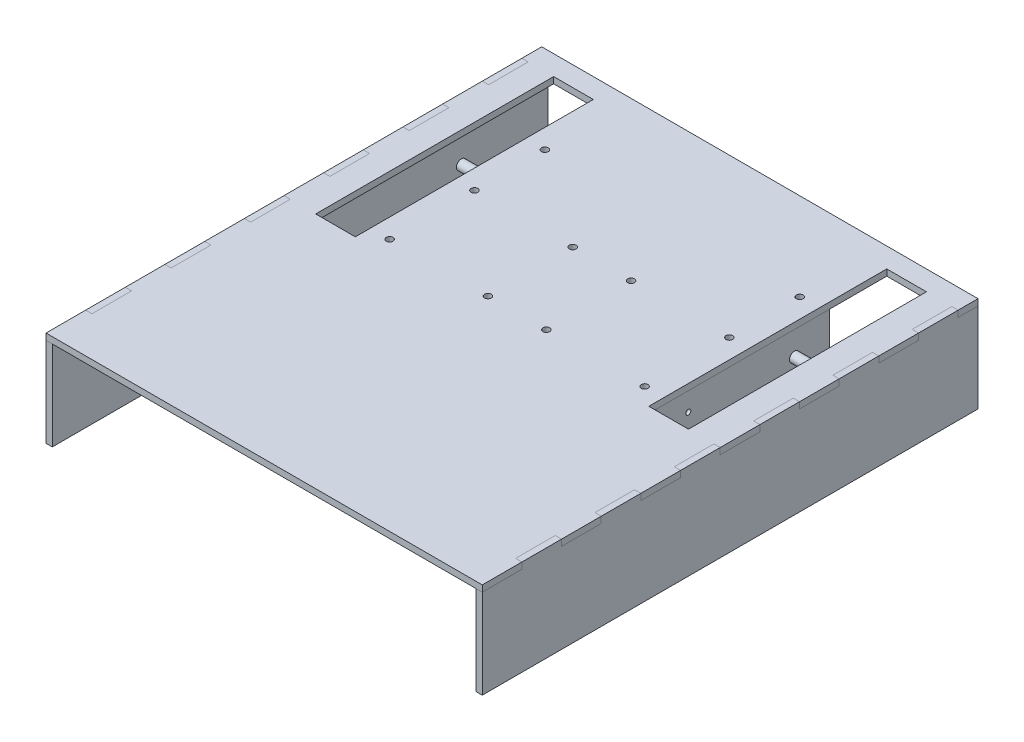
from build123d import *

# Parameters (mm, degrees)
SKETCH2_W           = 20
SKETCH2_H           = 120
BOSS_EXTRUDE1_DEPTH = 3.175
BOSS_EXTRUDE2_DEPTH = 3.175
BOSS_EXTRUDE3_DEPTH = 1.6129
SKETCH6_W           = 1.6129
SKETCH6_H           = 87.408244493
SKETCH6_R           = 17.56918
SKETCH6_R_2         = 2.55
SKETCH6_R_3         = 1.27
SKETCH6_R_4         = 2.3749
BOSS_EXTRUDE4_DEPTH = 1.6129
SKETCH7_R           = 1.7
CUT_EXTRUDE1_DEPTH  = 10
SKETCH9_R           = 2.5
BOSS_EXTRUDE6_DEPTH = 189


with BuildPart() as part:
    # Sketch2 → Boss-Extrude1 (new body)
    with BuildSketch(Plane(origin=(0, 0, 0), x_dir=(1, 0, 0), z_dir=(0, 1, 0))):
        Polygon((-162.266187111, -88.214102909), (57.733812889, -88.214102909), (57.733812889, -68.214102909), (54.558812889, -68.214102909), (54.558812889, -48.214102909), (57.733812889, -48.214102909), (57.733812889, -28.214102909), (54.558812889, -28.214102909), (54.558812889, -8.214102909), (57.733812889, -8.214102909), (57.733812889, 11.785897091), (54.558812889, 11.785897091), (54.558812889, 31.785897091), (57.733812889, 31.785897091), (57.733812889, 51.785897091), (54.558812889, 51.785897091), (54.558812889, 71.785897091), (57.733812889, 71.785897091), (57.733812889, 91.785897091), (54.558812889, 91.785897091), (54.558812889, 111.785897091), (57.733812889, 111.785897091), (57.733812889, 131.785897091), (54.558812889, 131.785897091), (54.558812889, 151.785897091), (57.733812889, 151.785897091), (57.733812889, 161.785897091), (-162.266187111, 161.785897091), (-162.266187111, 151.785897091), (-159.091187111, 151.785897091), (-159.091187111, 131.785897091), (-162.266187111, 131.785897091), (-162.266187111, 111.785897091), (-159.091187111, 111.785897091), (-159.091187111, 91.785897091), (-162.266187111, 91.785897091), (-162.266187111, 71.785897091), (-159.091187111, 71.785897091), (-159.091187111, 51.785897091), (-162.266187111, 51.785897091), (-162.266187111, 31.785897091), (-159.091187111, 31.785897091), (-159.091187111, 11.785897091), (-162.266187111, 11.785897091), (-162.266187111, -8.214102909), (-159.091187111, -8.214102909), (-159.091187111, -28.214102909), (-162.266187111, -28.214102909), (-162.266187111, -48.214102909), (-159.091187111, -48.214102909), (-159.091187111, -68.214102909), (-162.266187111, -68.214102909), align=None)
        with Locations((31.733812889, 91.785897091)):
            Rectangle(SKETCH2_W, SKETCH2_H, mode=Mode.SUBTRACT)
        with Locations((-136.266187111, 91.785897091)):
            Rectangle(SKETCH2_W, SKETCH2_H, mode=Mode.SUBTRACT)
    extrude(amount=BOSS_EXTRUDE1_DEPTH)


with BuildPart() as body_2:
    # Sketch3 → Boss-Extrude2 (new body)
    with BuildSketch(Plane.ZY.offset(159.091187111)):
        Polygon((68.214102909, 3.175), (68.214102909, 0), (88.214102909, 0), (88.214102909, -45), (-161.732040232, -45), (-161.732040232, 0), (-151.785897091, 0), (-151.785897091, 3.175), (-131.785897091, 3.175), (-131.785897091, 0), (-111.785897091, 0), (-111.785897091, 3.175), (-91.785897091, 3.175), (-91.785897091, 0), (-71.785897091, 0), (-71.785897091, 3.175), (-51.785897091, 3.175), (-51.785897091, 0), (-31.785897091, 0), (-31.785897091, 3.175), (-11.785897091, 3.175), (-11.785897091, 0), (8.214102909, 0), (8.214102909, 3.175), (28.214102909, 3.175), (28.214102909, 0), (48.214102909, 0), (48.214102909, 3.175), align=None)
    extrude(amount=BOSS_EXTRUDE2_DEPTH)


with BuildPart() as body_3:
    # Sketch4 → Boss-Extrude3 (new body)
    with BuildSketch(Plane.XZ):
        Polygon((-126.266187111, -122.812619878), (-126.266187111, -35.404375385), (-108.42560363, -35.404375385), (-108.42560363, -55.404375385), (-71.179527552, -55.404375385), (-71.179527552, -35.404375385), (-62.765041143, -35.404375385), (-62.765041143, -85.404375385), (-71.179527552, -85.404375385), (-71.179527552, -65.404375385), (-108.42560363, -65.404375385), (-108.42560363, -122.812619878), align=None)
    extrude(amount=BOSS_EXTRUDE3_DEPTH)

    # Sketch6 → Boss-Extrude4 (add)
    # profile 1 of 3: a face of its own
    with BuildSketch(Plane(origin=(-126.266187111, 113.834921078, 0), x_dir=(0, -1, 0), z_dir=(1, 0, 0))):
        with Locations((114.641371078, 79.108497632)):
            Rectangle(SKETCH6_W, SKETCH6_H)
    # profile 2 of 3: a face of its own
    with BuildSketch(Plane(origin=(-126.266187111, 113.834921078, 0), x_dir=(0, -1, 0), z_dir=(1, 0, 0))):
        with BuildLine():
            Line((115.447821078, 122.812619878), (115.447821078, 35.404375385))
            Line((115.447821078, 35.404375385), (133.404101078, 35.404375385))
            ThreePointArc((133.404101078, 35.404375385), (158.380306618, 59.313890701), (135.582994647, 85.309242837))
            Line((135.582994647, 85.309242837), (135.582994647, 122.812619878))
            Line((135.582994647, 122.812619878), (115.447821078, 122.812619878))
        make_face()
        with Locations((133.404101078, 60.404375385)):
            Circle(SKETCH6_R, mode=Mode.SUBTRACT)
        with Locations((125.834921078, 105.254818177)):
            Circle(SKETCH6_R_2, mode=Mode.SUBTRACT)
    # profile 3 of 3: a face of its own
    with BuildSketch(Plane(origin=(-126.266187111, 113.834921078, 0), x_dir=(0, -1, 0), z_dir=(1, 0, 0))):
        with Locations((133.404101078, 60.404375385)):
            Circle(SKETCH6_R)
        with Locations((123.193301078, 51.685825385)):
            Circle(SKETCH6_R_3, mode=Mode.SUBTRACT)
        with Locations((133.404101078, 73.860025385)):
            Circle(SKETCH6_R_3, mode=Mode.SUBTRACT)
        with Locations((133.404101078, 51.685825385)):
            Circle(SKETCH6_R_4, mode=Mode.SUBTRACT)
        with Locations((143.614901078, 51.685825385)):
            Circle(SKETCH6_R_3, mode=Mode.SUBTRACT)
    extrude(amount=BOSS_EXTRUDE4_DEPTH)


with BuildPart() as cut_extrude1_tool:
    # Sketch7 → Cut-Extrude1 (new body)
    with BuildSketch(Plane.XZ.offset(1.6129)):
        with Locations((-116.53944537, -82.124992621)):
            Circle(SKETCH7_R)
        with Locations((-116.53944537, -39.376753643)):
            Circle(SKETCH7_R)
        with Locations((-66.972284348, -39.376753643)):
            Circle(SKETCH7_R)
        with Locations((-66.972284348, -82.124992621)):
            Circle(SKETCH7_R)
        with Locations((-116.53944537, -117.626879184)):
            Circle(SKETCH7_R)
    cut_extrude1 = extrude(amount=-CUT_EXTRUDE1_DEPTH)


with BuildPart() as part_1:
    add(part.part)

    # Cut-Extrude1: cut by cut_extrude1_tool
    add(cut_extrude1_tool.part, mode=Mode.SUBTRACT)

    # Mirror2: Cut-Extrude1 across plane
    add(cut_extrude1.mirror(Plane.ZY.offset(52.266187111)), mode=Mode.SUBTRACT)


with BuildPart() as body_3_1:
    add(body_3.part)

    # Cut-Extrude1: cut by cut_extrude1_tool
    add(cut_extrude1_tool.part, mode=Mode.SUBTRACT)


with BuildPart() as body_4:
    # Mirror1: mirrored copy
    add(body_3_1.part.mirror(Plane.ZY.offset(52.266187111)))


with BuildPart() as body_5:
    # Mirror1 2: mirrored copy
    add(body_2.part.mirror(Plane.ZY.offset(52.266187111)))


with BuildPart() as body_6:
    # Sketch9 → Boss-Extrude6 (new body)
    with BuildSketch(Plane(origin=(-146.266187111, 0, 0), x_dir=(0, 0, -1), z_dir=(1, 0, 0))):
        with Locations((105.254818177, -12)):
            Circle(SKETCH9_R)
    extrude(amount=BOSS_EXTRUDE6_DEPTH)


solid = Compound([body_2.part, part_1.part, body_3_1.part, body_4.part, body_5.part, body_6.part])
